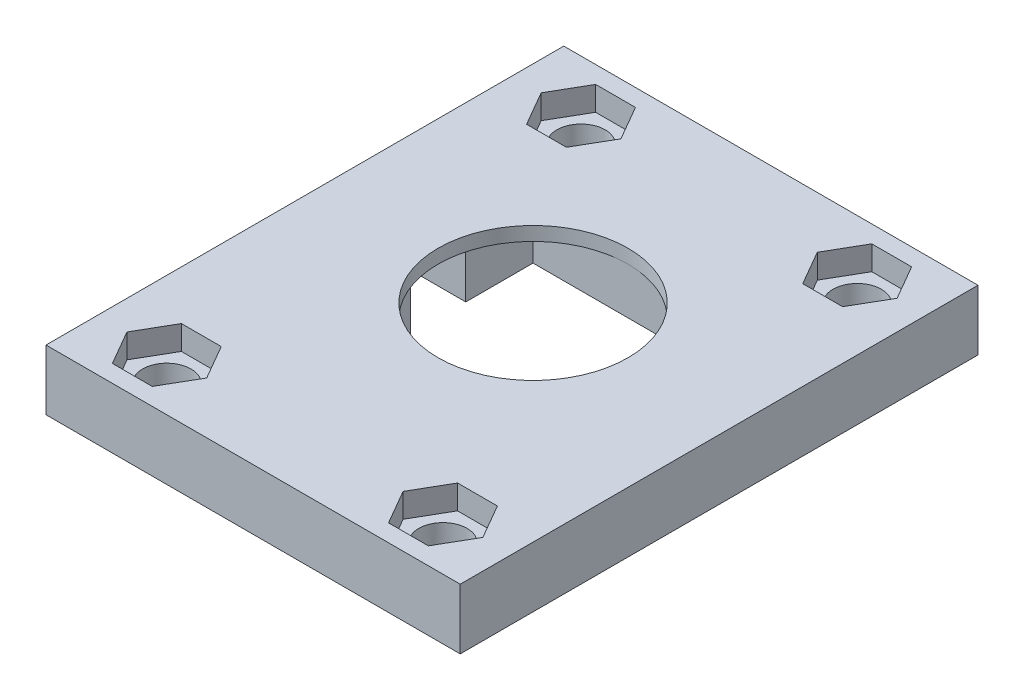
from build123d import *

# Parameters (mm, degrees)
SKETCH1_W           = 30.48
SKETCH1_H           = 38.1
SKETCH1_R           = 1.778
BOSS_EXTRUDE1_DEPTH = 4.445
SKETCH2_R           = 1.778
SKETCH2_R_2         = 6.985
CUT_EXTRUDE1_DEPTH  = 25.797542721
CUT_EXTRUDE2_DEPTH  = 3.429
CUT_EXTRUDE3_DEPTH  = 1.778


with BuildPart() as part:
    # Sketch1 → Boss-Extrude1 (new body)
    with BuildSketch(Plane(origin=(0, 0, 0), x_dir=(1, 0, 0), z_dir=(0, 1, 0))):
        Rectangle(SKETCH1_W, SKETCH1_H)
        with Locations((-10.16, 15.24)):
            Circle(SKETCH1_R, mode=Mode.SUBTRACT)
        with Locations((10.16, 15.24)):
            Circle(SKETCH1_R, mode=Mode.SUBTRACT)
        with Locations((-10.16, -15.24)):
            Circle(SKETCH1_R, mode=Mode.SUBTRACT)
        with Locations((10.16, -15.24)):
            Circle(SKETCH1_R, mode=Mode.SUBTRACT)
    extrude(amount=BOSS_EXTRUDE1_DEPTH)

    # Sketch2 → Cut-Extrude1 (cut, through all)
    with BuildSketch(Plane.XZ):
        with Locations((-10.16, -15.24)):
            Circle(SKETCH2_R)
        with Locations((10.16, -15.24)):
            Circle(SKETCH2_R)
        with Locations((10.16, 15.24)):
            Circle(SKETCH2_R)
        with Locations((-10.16, 15.24)):
            Circle(SKETCH2_R)
        with Locations((0, -1.5494)):
            Circle(SKETCH2_R_2)
    extrude(amount=-CUT_EXTRUDE1_DEPTH, mode=Mode.SUBTRACT)

    # Sketch3 → Cut-Extrude2 (cut)
    with BuildSketch(Plane.XZ):
        with BuildLine():
            Line((-6.985, -3.5814), (-6.985, -8.5344))
            Line((-6.985, -8.5344), (0, -8.5344))
            ThreePointArc((0, -8.5344), (-6.985, -1.549399996), (9e-09, 5.4356))
            Line((9e-09, 5.4356), (-6.985, 5.4356))
            Line((-6.985, 5.4356), (-6.985, 0.4826))
            Line((-6.985, 0.4826), (-11.049, 0.4826))
            Line((-11.049, 0.4826), (-11.049, -3.5814))
            Line((-11.049, -3.5814), (-6.985, -3.5814))
        make_face()
        with BuildLine():
            Line((0, -8.5344), (6.985, -8.5344))
            Line((6.985, -8.5344), (6.985, -3.5814))
            Line((6.985, -3.5814), (11.049, -3.5814))
            Line((11.049, -3.5814), (11.049, 0.4826))
            Line((11.049, 0.4826), (6.985, 0.4826))
            Line((6.985, 0.4826), (6.985, 5.4356))
            Line((6.985, 5.4356), (9e-09, 5.4356))
            ThreePointArc((9e-09, 5.4356), (6.985, -1.549400004), (0, -8.5344))
        make_face()
    extrude(amount=-CUT_EXTRUDE2_DEPTH, mode=Mode.SUBTRACT)

    # Sketch4 → Cut-Extrude3 (cut)
    with BuildSketch(Plane(origin=(0, 4.445, 0), x_dir=(1, 0, 0), z_dir=(0, 1, 0))):
        Polygon((-7.227060633, 15.24), (-8.693530316, 17.78), (-11.626469684, 17.78), (-13.092939367, 15.24), (-11.626469684, 12.7), (-8.693530316, 12.7), align=None)
        Polygon((8.693530316, 12.7), (7.227060633, 15.24), (8.693530316, 17.78), (11.626469684, 17.78), (13.092939367, 15.24), (11.626469684, 12.7), align=None)
        Polygon((11.626469684, -12.7), (8.693530316, -12.7), (7.227060633, -15.24), (8.693530316, -17.78), (11.626469684, -17.78), (13.092939367, -15.24), align=None)
        Polygon((-8.693530316, -12.7), (-7.227060633, -15.24), (-8.693530316, -17.78), (-11.626469684, -17.78), (-13.092939367, -15.24), (-11.626469684, -12.7), align=None)
    extrude(amount=-CUT_EXTRUDE3_DEPTH, mode=Mode.SUBTRACT)


solid = part.part
